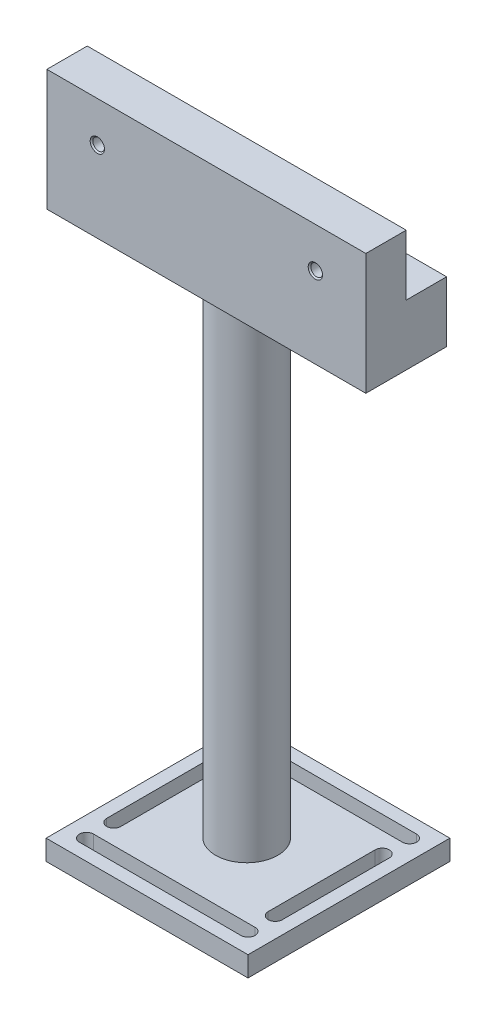
from build123d import *

# Parameters (mm, degrees)
SKETCH_1_W                     = 79
SKETCH_1_H                     = 30
EXTRUDE_2_DEPTH                = 10
HOLE_WIZARD_M3_5_3_D           = 2.9
HOLE_WIZARD_M3_5_3_CSINK_D     = 3.55
HOLE_WIZARD_M3_5_3_CSINK_ANGLE = 90
SKETCH_9_W                     = 79
SKETCH_9_H                     = 15
EXTRUDE_3_DEPTH                = 10
SKETCH_10_R                    = 7.701725444
EXTRUDE_4_DEPTH                = 120
SKETCH_11_W                    = 50
SKETCH_11_H                    = 50
EXTRUDE_5_DEPTH                = 5
CUT_EXTRUDE_2_DEPTH            = 40
CUT_EXTRUDE_3_DEPTH            = 40
FILLET_3_R                     = 1


with BuildPart() as part:
    # 草图1 → 凸台-拉伸2 (new body)
    with BuildSketch(Plane.XY):
        with Locations((39.5, 15)):
            Rectangle(SKETCH_1_W, SKETCH_1_H)
    extrude(amount=EXTRUDE_2_DEPTH)

    # M3.5 螺纹孔3 (through all)
    with Locations(Plane.XY.offset(10)):
        with Locations((12.5, 20), (66.5, 20)):
            CounterSinkHole(HOLE_WIZARD_M3_5_3_D / 2, HOLE_WIZARD_M3_5_3_CSINK_D / 2, counter_sink_angle=HOLE_WIZARD_M3_5_3_CSINK_ANGLE)

    # 草图9 → 凸台-拉伸3 (add)
    with BuildSketch(Plane(origin=(0, 0, 0), x_dir=(-1, 0, 0), z_dir=(0, 0, -1))):
        with Locations((-39.5, 7.5)):
            Rectangle(SKETCH_9_W, SKETCH_9_H)
    extrude(amount=EXTRUDE_3_DEPTH)

    # 草图10 → 凸台-拉伸4 (add)
    with BuildSketch(Plane.XZ):
        with Locations((39.5, 0)):
            Circle(SKETCH_10_R)
    extrude(amount=EXTRUDE_4_DEPTH)

    # 草图11 → 凸台-拉伸5 (add)
    with BuildSketch(Plane.XZ.offset(120)):
        with Locations((39.813489276, 0)):
            Rectangle(SKETCH_11_W, SKETCH_11_H)
    extrude(amount=EXTRUDE_5_DEPTH)

    # 草图12 → 切除-拉伸2 (cut)
    with BuildSketch(Plane.XZ.offset(125)):
        with BuildLine():
            Line((19.813489276, 21.75), (59.813489276, 21.75))
            ThreePointArc((59.813489276, 21.75), (61.563489276, 20), (59.813489276, 18.25))
            Line((59.813489276, 18.25), (19.813489276, 18.25))
            ThreePointArc((19.813489276, 18.25), (18.063489276, 20), (19.813489276, 21.75))
        make_face()
    extrude(amount=-CUT_EXTRUDE_2_DEPTH, mode=Mode.SUBTRACT)

    # 草图12<3> → 切除-拉伸3 (cut)
    with BuildSketch(Plane.XZ.offset(125)):
        with BuildLine():
            Line((19.813489276, 21.75), (59.813489276, 21.75))
            ThreePointArc((59.813489276, 21.75), (61.563489276, 20), (59.813489276, 18.25))
            Line((59.813489276, 18.25), (19.813489276, 18.25))
            ThreePointArc((19.813489276, 18.25), (18.063489276, 20), (19.813489276, 21.75))
        make_face()
        with BuildLine():
            Line((19.813489276, -21.75), (59.813489276, -21.75))
            ThreePointArc((59.813489276, -21.75), (61.563489276, -20), (59.813489276, -18.25))
            Line((59.813489276, -18.25), (19.813489276, -18.25))
            ThreePointArc((19.813489276, -18.25), (18.063489276, -20), (19.813489276, -21.75))
        make_face()
        with BuildLine():
            Line((21.563489276, 13.25), (21.563489276, -13.25))
            ThreePointArc((21.563489276, -13.25), (19.813489276, -15), (18.063489276, -13.25))
            Line((18.063489276, -13.25), (18.063489276, 13.25))
            ThreePointArc((18.063489276, 13.25), (19.813489276, 15), (21.563489276, 13.25))
        make_face()
        with BuildLine():
            Line((58.063489276, 13.25), (58.063489276, -13.25))
            ThreePointArc((58.063489276, -13.25), (59.813489276, -15), (61.563489276, -13.25))
            Line((61.563489276, -13.25), (61.563489276, 13.25))
            ThreePointArc((61.563489276, 13.25), (59.813489276, 15), (58.063489276, 13.25))
        make_face()
    extrude(amount=-CUT_EXTRUDE_3_DEPTH, mode=Mode.SUBTRACT)

    # 圆角3
    fillet_3_edges = [part.edges().sort_by_distance(p)[0] for p in [
        (59.813489276, -125, 15),
        (61.563489276, -125, 0),
        (59.813489276, -125, -15),
        (19.813489276, -125, -15),
        (18.063489276, -125, 0),
        (19.813489276, -125, 15),
        (18.063489276, -125, 20),
        (39.813489276, -125, 21.75),
        (61.563489276, -125, 20),
        (58.063489276, -125, 0),
        (21.563489276, -125, 0),
        (39.813489276, -125, 18.25),
        (18.063489276, -125, -20),
        (39.813489276, -125, -18.25),
        (61.563489276, -125, -20),
        (39.813489276, -125, -21.75),
    ]]
    fillet(fillet_3_edges, radius=FILLET_3_R)


solid = part.part
